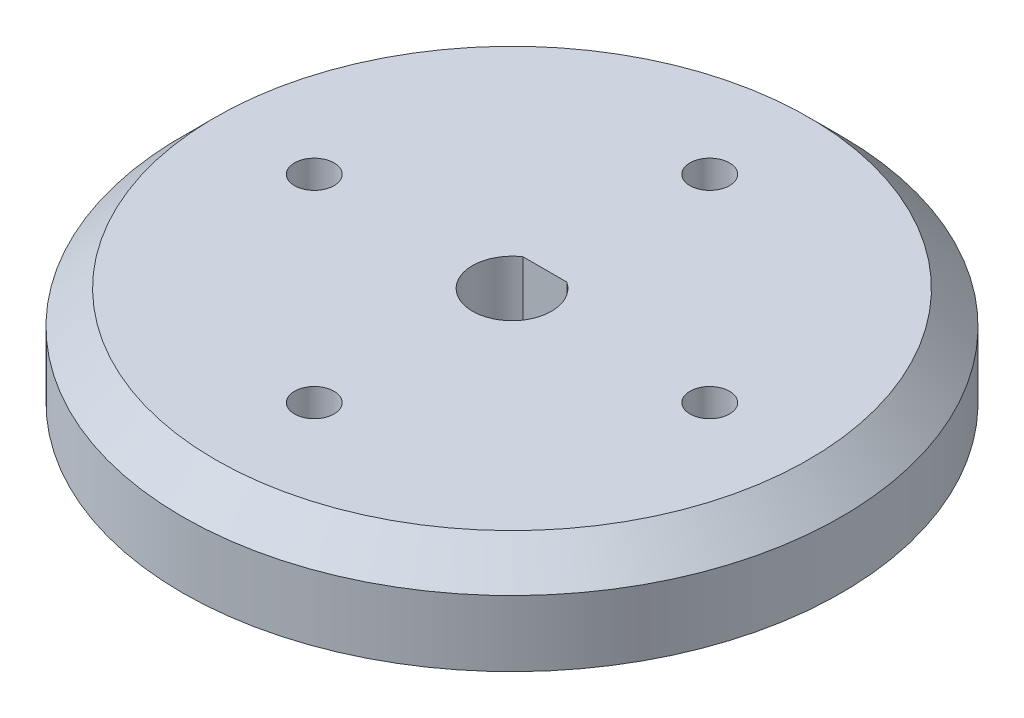
from build123d import *

# Parameters (mm, degrees)
SKETCH1_R           = 25
SKETCH1_R_2         = 1.5
BOSS_EXTRUDE1_DEPTH = 7.5
CHAMFER1_SIZE       = 2.5


with BuildPart() as part:
    # Sketch1 → Boss-Extrude1 (new body)
    with BuildSketch(Plane(origin=(0, 0, 0), x_dir=(1, 0, 0), z_dir=(0, 1, 0))):
        Circle(SKETCH1_R)
        with Locations((0, 15)):
            Circle(SKETCH1_R_2, mode=Mode.SUBTRACT)
        with Locations((15, 0)):
            Circle(SKETCH1_R_2, mode=Mode.SUBTRACT)
        with Locations((0, -15)):
            Circle(SKETCH1_R_2, mode=Mode.SUBTRACT)
        with Locations((-15, 0)):
            Circle(SKETCH1_R_2, mode=Mode.SUBTRACT)
        with BuildLine():
            Line((-1.658312395, 2.5), (1.658312395, 2.5))
            ThreePointArc((1.658312395, 2.5), (0, -3), (-1.658312395, 2.5))
        make_face(mode=Mode.SUBTRACT)
    extrude(amount=BOSS_EXTRUDE1_DEPTH)

    # Chamfer1
    chamfer1_edges = [part.edges().sort_by_distance(p)[0] for p in [
        (-25, 7.5, 0),
    ]]
    chamfer(chamfer1_edges, length=CHAMFER1_SIZE)


solid = part.part
